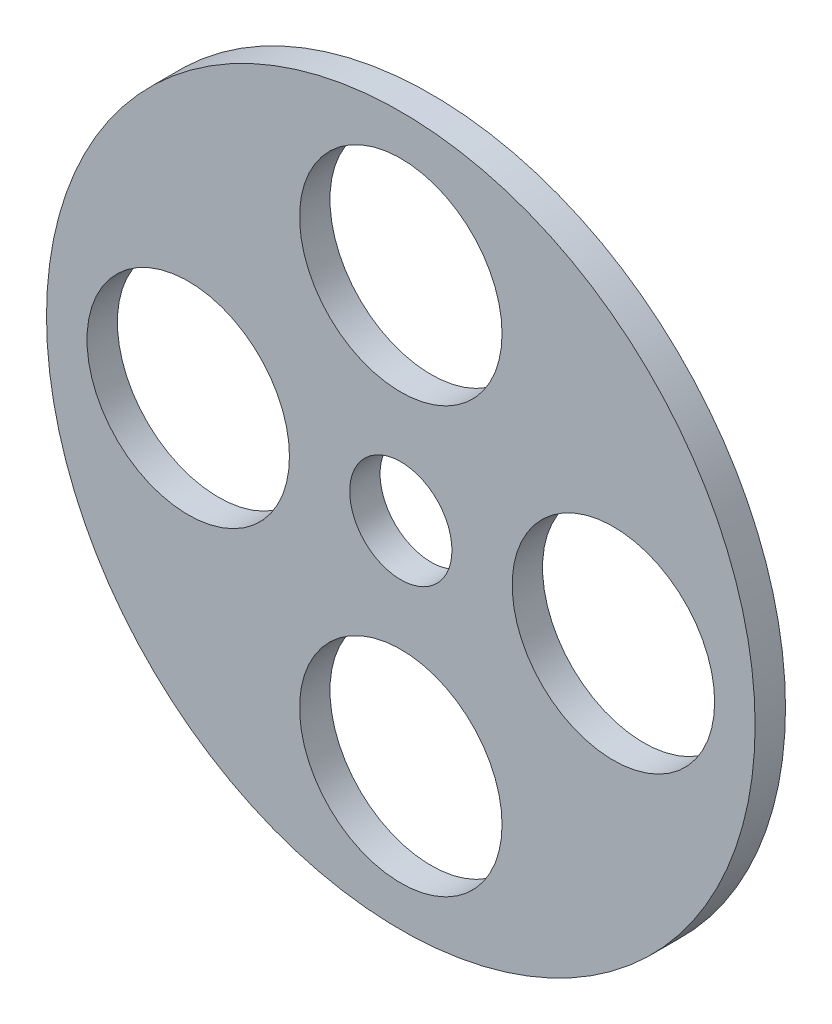
from build123d import *

# Parameters (mm, degrees)
ESQUISSE1_R        = 35
ESQUISSE1_R_2      = 5.05
ESQUISSE1_R_3      = 10
BOSS_EXTRU_1_DEPTH = 3


with BuildPart() as part:
    # Esquisse1 → Boss.-Extru.1 (new body)
    with BuildSketch(Plane.XY):
        Circle(ESQUISSE1_R)
        Circle(ESQUISSE1_R_2, mode=Mode.SUBTRACT)
        with Locations((0, 21)):
            Circle(ESQUISSE1_R_3, mode=Mode.SUBTRACT)
        with Locations((21, 0)):
            Circle(ESQUISSE1_R_3, mode=Mode.SUBTRACT)
        with Locations((0, -21)):
            Circle(ESQUISSE1_R_3, mode=Mode.SUBTRACT)
        with Locations((-21, 0)):
            Circle(ESQUISSE1_R_3, mode=Mode.SUBTRACT)
    extrude(amount=BOSS_EXTRU_1_DEPTH)


solid = part.part
